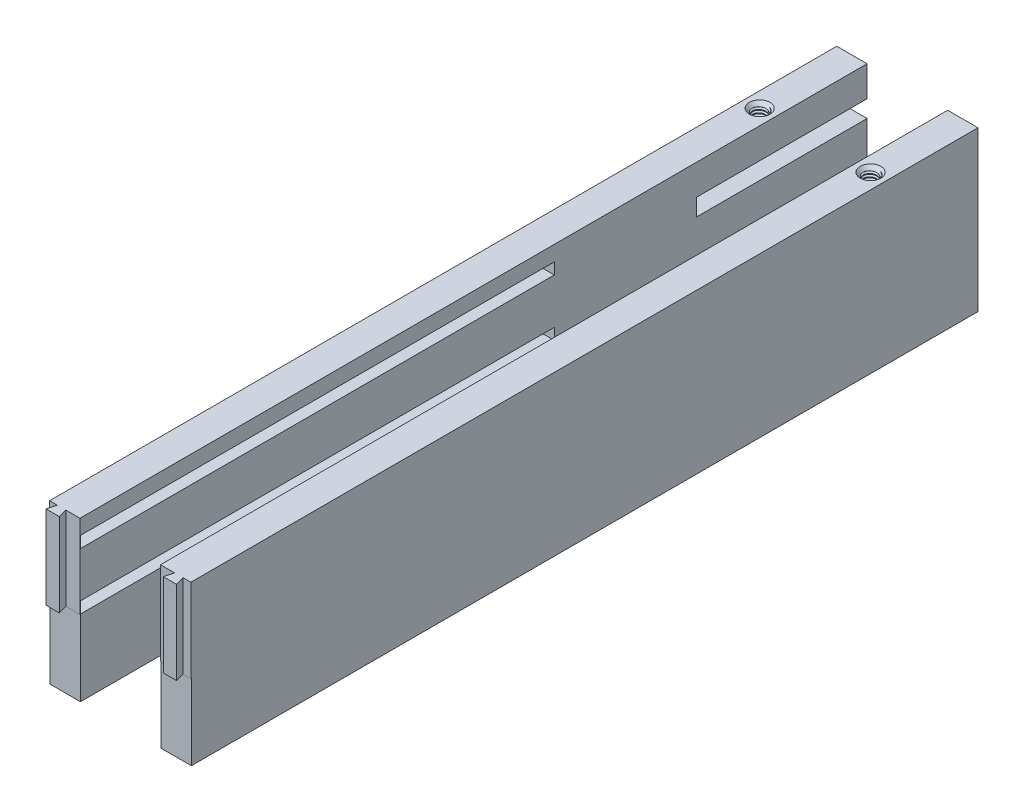
from build123d import *

# Parameters (mm, degrees)
SKETCH1_W                      = 210
SKETCH1_H                      = 42
BOSS_EXTRUDE1_DEPTH            = 8
CUT_EXTRUDE8_DEPTH             = 25
SKETCH13_W                     = 8
SKETCH13_H                     = 2.5
CUT_EXTRUDE9_DEPTH             = 20
SKETCH43_W                     = 5
SKETCH43_H                     = 15
BOSS_EXTRUDE8_DEPTH            = 6
SKETCH44_W                     = 15
SKETCH44_H                     = 6
BOSS_EXTRUDE9_DEPTH            = 6
SKETCH46_W                     = 3.090638796
SKETCH46_H                     = 3
CUT_EXTRUDE15_DEPTH            = 125
SKETCH23_W                     = 4.5
SKETCH23_H                     = 4.5
CUT_EXTRUDE14_DEPTH            = 45
F_8_32_TAPPED_HOLE1_AT_2_COUNT = 2
F_8_32_TAPPED_HOLE1_AT_2_PITCH = 29.25
THREAD3_PITCH                  = 0.79375
THREAD4_PITCH                  = 0.79375


with BuildPart() as part:
    # Sketch1 → Boss-Extrude1 (new body)
    with BuildSketch(Plane(origin=(0, 0, 0), x_dir=(0, 0, -1), z_dir=(1, 0, 0))):
        with Locations((40.195219221, -11.820528122)):
            Rectangle(SKETCH1_W, SKETCH1_H)
    extrude(amount=BOSS_EXTRUDE1_DEPTH)

    # Sketch12 → Cut-Extrude8 (cut)
    with BuildSketch(Plane(origin=(0, 9.179471878, 0), x_dir=(1, 0, 0), z_dir=(0, 1, 0))):
        Polygon((0, -62.454780779), (2.029680602, -62.454780779), (1.4, -64.804780779), (0, -64.804780779), align=None)
        Polygon((8, -62.454780779), (8, -64.804780779), (4.909361204, -64.804780779), (4.279680602, -62.454780779), align=None)
    extrude(amount=-CUT_EXTRUDE8_DEPTH, mode=Mode.SUBTRACT)

    # Sketch13 → Cut-Extrude9 (cut)
    with BuildSketch(Plane.XZ.offset(32.820528122)):
        with Locations((4, 63.554780779)):
            Rectangle(SKETCH13_W, SKETCH13_H)
    extrude(amount=-CUT_EXTRUDE9_DEPTH, mode=Mode.SUBTRACT)

    # Sketch43 → Boss-Extrude8 (add)
    with BuildSketch(Plane(origin=(8, 0, 0), x_dir=(0, 0, -1), z_dir=(1, 0, 0))):
        with Locations((137.695219221, -20.320528122)):
            Rectangle(SKETCH43_W, SKETCH43_H)
    extrude(amount=BOSS_EXTRUDE8_DEPTH)

    # Sketch44 → Boss-Extrude9 (add)
    with BuildSketch(Plane(origin=(8, 0, 0), x_dir=(0, 0, -1), z_dir=(1, 0, 0))):
        with Locations((122.695219221, -29.820528122)):
            Rectangle(SKETCH44_W, SKETCH44_H)
    extrude(amount=BOSS_EXTRUDE9_DEPTH)

    # Sketch46 → Cut-Extrude15 (cut)
    with BuildSketch(Plane.XY.offset(62.304780779)):
        with Locations((6.454680602, 3.679471878)):
            Rectangle(SKETCH46_W, SKETCH46_H)
        Polygon((8, -9.770528122), (8, -12.770528122), (4.909361204, -12.770528122), (4.812951043, -9.770528122), align=None)
    extrude(amount=-CUT_EXTRUDE15_DEPTH, mode=Mode.SUBTRACT)

    # Sketch23 → Cut-Extrude14 (cut)
    with BuildSketch(Plane(origin=(0, 0, -145.195219221), x_dir=(-1, 0, 0), z_dir=(0, 0, -1))):
        with Locations((-5.75, -1.070528122)):
            Rectangle(SKETCH23_W, SKETCH23_H)
    extrude(amount=-CUT_EXTRUDE14_DEPTH, mode=Mode.SUBTRACT)


with BuildPart() as body_2:
    # Mirror4: mirrored copy
    add(part.part.mirror(Plane.ZY.offset(-18.625)))

    # Sketch37 → #8-32 Tapped Hole1 (revolve, cut)
    with BuildSketch(Plane(origin=(33.25, 9.179471878, -120.853800947), x_dir=(0, 0, 1), z_dir=(1, 0, 0))):
        Polygon((0, 0), (0, 10.70744), (1.7272, 9.669633539), (1.7272, 0.9906), (2.7178, 0), align=None)
    f_8_32_tapped_hole1 = revolve(axis=Axis((33.25, 15.529471878, -120.853800947), (0, -1, 0)), mode=Mode.SUBTRACT)

    # Thread3: the profile of Thread Profile5 profile screwed along a right-hand helix of 12.598425 turns, 8 arcs to a turn; built about Z, then put on its axis
    thread3_z = Axis((0, 0, 0), (0, 0, 1))
    thread3_corners = [(1.7269, 0, -0.000173205), (2.156829788, 0, 0.248046874), (2.156829788, 0, 0.347265624), (1.7269, 0, 0.595485703)]
    with BuildLine(mode=Mode.PRIVATE) as thread3_profile:
        Line(thread3_corners[0], thread3_corners[1])
        Line(thread3_corners[1], thread3_corners[2])
        Line(thread3_corners[2], thread3_corners[3])
        Line(thread3_corners[3], thread3_corners[0])
    thread3_cap = Face(thread3_profile.wire())
    thread3_turn_angles = [0, 22.5, 45, 67.5, 90, 112.5, 135, 157.5, 180, 202.5, 225, 247.5, 270, 292.5, 315, 337.5, 360]
    thread3_turn_weights = [1, 0.9238795325112867, 1, 0.9238795325112867, 1, 0.9238795325112867, 1, 0.9238795325112867, 1, 0.9238795325112867, 1, 0.9238795325112867, 1, 0.9238795325112867, 1, 0.9238795325112867, 1]
    thread3_turn_rails = [Edge.make_bspline([Vector(p[0], p[1], 0).rotate(thread3_z, thread3_turn_angles[k]) / thread3_turn_weights[k] + Vector(0, 0, p[2] + THREAD3_PITCH * thread3_turn_angles[k] / 360) for k in range(17)], [0, 0, 0, 1, 1, 2, 2, 3, 3, 4, 4, 5, 5, 6, 6, 7, 7, 8, 8, 8], 2, thread3_turn_weights) for p in thread3_corners]
    thread3_turn_sides = [Face.make_surface_from_curves(thread3_turn_rails[p[0]], thread3_turn_rails[p[1]]) for p in [(0, 1), (1, 2), (2, 3), (3, 0)]]
    thread3_last_angles = [4320, 4342.5, 4365, 4387.5, 4410, 4432.5, 4455, 4477.5, 4500, 4517.716535433, 4535.433070866]
    thread3_last_weights = [1, 0.9238795325112867, 1, 0.9238795325112867, 1, 0.9238795325112867, 1, 0.9238795325112867, 1, 0.9525736983244454, 1]
    thread3_last_rails = [Edge.make_bspline([Vector(p[0], p[1], 0).rotate(thread3_z, thread3_last_angles[k]) / thread3_last_weights[k] + Vector(0, 0, p[2] + THREAD3_PITCH * thread3_last_angles[k] / 360) for k in range(11)], [0, 0, 0, 1, 1, 2, 2, 3, 3, 4, 4, 5, 5, 5], 2, thread3_last_weights) for p in thread3_corners]
    thread3_last_sides = [Face.make_surface_from_curves(thread3_last_rails[p[0]], thread3_last_rails[p[1]]) for p in [(0, 1), (1, 2), (2, 3), (3, 0)]]
    thread3 = Plane(origin=(33.25, 9.188871878, -120.853800947), x_dir=(-1, 0, 0), z_dir=(0, -1, 0)) * Solid(Shell([*[p.moved(Location((0, 0, THREAD3_PITCH * i))) for i in range(12) for p in thread3_turn_sides], *thread3_last_sides, thread3_cap, thread3_cap.rotate(thread3_z, 4535.433070866).moved(Location((0, 0, THREAD3_PITCH * 4535.433070866 / 360)))]))
    add(thread3, mode=Mode.SUBTRACT)


with BuildPart() as part_1:
    add(part.part)

    # #8-32 Tapped Hole1 at 2: #8-32 Tapped Hole1 ×2
    with Locations(*[(-i * F_8_32_TAPPED_HOLE1_AT_2_PITCH, 0, 0) for i in range(1, F_8_32_TAPPED_HOLE1_AT_2_COUNT)]):
        add(f_8_32_tapped_hole1, mode=Mode.SUBTRACT)

    # Thread4: the profile of Thread Profile6 profile screwed along a right-hand helix of 12.598425 turns, 8 arcs to a turn; built about Z, then put on its axis
    thread4_z = Axis((0, 0, 0), (0, 0, 1))
    thread4_corners = [(1.7269, 0, -0.000173205), (2.156829788, 0, 0.248046874), (2.156829788, 0, 0.347265624), (1.7269, 0, 0.595485703)]
    with BuildLine(mode=Mode.PRIVATE) as thread4_profile:
        Line(thread4_corners[0], thread4_corners[1])
        Line(thread4_corners[1], thread4_corners[2])
        Line(thread4_corners[2], thread4_corners[3])
        Line(thread4_corners[3], thread4_corners[0])
    thread4_cap = Face(thread4_profile.wire())
    thread4_turn_angles = [0, 22.5, 45, 67.5, 90, 112.5, 135, 157.5, 180, 202.5, 225, 247.5, 270, 292.5, 315, 337.5, 360]
    thread4_turn_weights = [1, 0.9238795325112867, 1, 0.9238795325112867, 1, 0.9238795325112867, 1, 0.9238795325112867, 1, 0.9238795325112867, 1, 0.9238795325112867, 1, 0.9238795325112867, 1, 0.9238795325112867, 1]
    thread4_turn_rails = [Edge.make_bspline([Vector(p[0], p[1], 0).rotate(thread4_z, thread4_turn_angles[k]) / thread4_turn_weights[k] + Vector(0, 0, p[2] + THREAD4_PITCH * thread4_turn_angles[k] / 360) for k in range(17)], [0, 0, 0, 1, 1, 2, 2, 3, 3, 4, 4, 5, 5, 6, 6, 7, 7, 8, 8, 8], 2, thread4_turn_weights) for p in thread4_corners]
    thread4_turn_sides = [Face.make_surface_from_curves(thread4_turn_rails[p[0]], thread4_turn_rails[p[1]]) for p in [(0, 1), (1, 2), (2, 3), (3, 0)]]
    thread4_last_angles = [4320, 4342.5, 4365, 4387.5, 4410, 4432.5, 4455, 4477.5, 4500, 4517.716535433, 4535.433070866]
    thread4_last_weights = [1, 0.9238795325112867, 1, 0.9238795325112867, 1, 0.9238795325112867, 1, 0.9238795325112867, 1, 0.9525736983244454, 1]
    thread4_last_rails = [Edge.make_bspline([Vector(p[0], p[1], 0).rotate(thread4_z, thread4_last_angles[k]) / thread4_last_weights[k] + Vector(0, 0, p[2] + THREAD4_PITCH * thread4_last_angles[k] / 360) for k in range(11)], [0, 0, 0, 1, 1, 2, 2, 3, 3, 4, 4, 5, 5, 5], 2, thread4_last_weights) for p in thread4_corners]
    thread4_last_sides = [Face.make_surface_from_curves(thread4_last_rails[p[0]], thread4_last_rails[p[1]]) for p in [(0, 1), (1, 2), (2, 3), (3, 0)]]
    thread4 = Plane(origin=(4, 9.188871878, -120.853800947), x_dir=(-1, 0, 0), z_dir=(0, -1, 0)) * Solid(Shell([*[p.moved(Location((0, 0, THREAD4_PITCH * i))) for i in range(12) for p in thread4_turn_sides], *thread4_last_sides, thread4_cap, thread4_cap.rotate(thread4_z, 4535.433070866).moved(Location((0, 0, THREAD4_PITCH * 4535.433070866 / 360)))]))
    add(thread4, mode=Mode.SUBTRACT)


solid = Compound([body_2.part, part_1.part])
